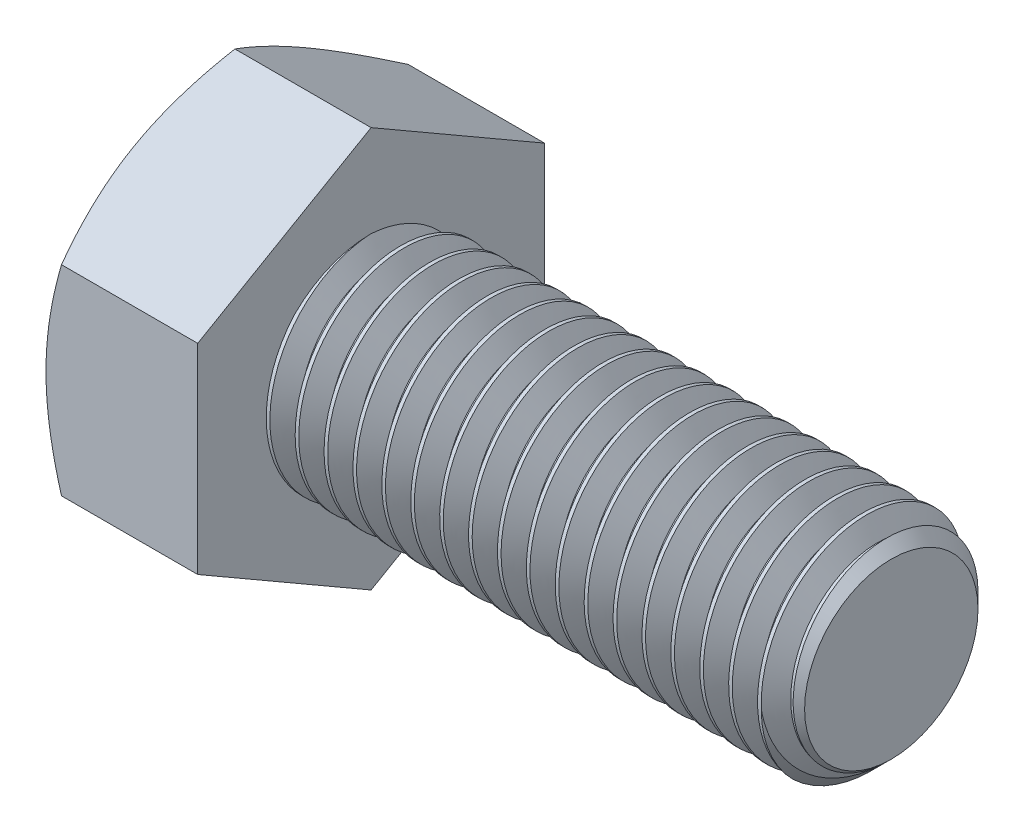
from build123d import *

# Parameters (mm, degrees)
SKETCH5_R           = 3.96875
BOSS_EXTRUDE3_DEPTH = 19.05
CHAMFER1_SIZE       = 0.79375
CUT_SWEEP1_PITCH    = 1.058333333
BOSS_EXTRUDE4_DEPTH = 5.55625
SKETCH8_OUTSIDE_W   = 116.054
SKETCH8_OUTSIDE_H   = 118.018
SKETCH8_OUTSIDE_R   = 6.35
CUT_EXTRUDE3_DEPTH  = 27.44907144
CUT_EXTRUDE3_DRAFT  = -60
CUT_EXTRUDE4_DEPTH  = 0.254
CIRPATTERN1_COUNT   = 6


with BuildPart() as part:
    # Sketch5 → Boss-Extrude3 (new body)
    with BuildSketch(Plane(origin=(12.303125, 0, 0), x_dir=(0, 0, -1), z_dir=(1, 0, 0))):
        Circle(SKETCH5_R)
    extrude(amount=-BOSS_EXTRUDE3_DEPTH)

    # Chamfer1
    chamfer1_edges = [part.edges().sort_by_distance(p)[0] for p in [
        (12.303125, 0, 3.96875),
    ]]
    chamfer(chamfer1_edges, length=CHAMFER1_SIZE)

    # Cut-Sweep1: arcs per turn and ends read off the stored shape
    # Cut-Sweep1: the profile of Sketch10 profile screwed along a right-hand helix through 19 turns, 8 arcs to a turn; built about Z, then put on its axis
    cut_sweep1_z = Axis((0, 0, 0), (0, 0, 1))
    cut_sweep1_corners = [(3.96905, 0, 0.000173205), (3.281342336, 0, -0.396875), (3.281342336, 0, -0.529166667), (3.96905, 0, -0.926214872)]
    with BuildLine(mode=Mode.PRIVATE) as cut_sweep1_profile:
        Line(cut_sweep1_corners[0], cut_sweep1_corners[1])
        Line(cut_sweep1_corners[1], cut_sweep1_corners[2])
        Line(cut_sweep1_corners[2], cut_sweep1_corners[3])
        Line(cut_sweep1_corners[3], cut_sweep1_corners[0])
    cut_sweep1_cap = Face(cut_sweep1_profile.wire())
    cut_sweep1_turn_angles = [0, 22.5, 45, 67.5, 90, 112.5, 135, 157.5, 180, 202.5, 225, 247.5, 270, 292.5, 315, 337.5, 360]
    cut_sweep1_turn_weights = [1, 0.9238795325112867, 1, 0.9238795325112867, 1, 0.9238795325112867, 1, 0.9238795325112867, 1, 0.9238795325112867, 1, 0.9238795325112867, 1, 0.9238795325112867, 1, 0.9238795325112867, 1]
    cut_sweep1_turn_rails = [Edge.make_bspline([Vector(p[0], p[1], 0).rotate(cut_sweep1_z, cut_sweep1_turn_angles[k]) / cut_sweep1_turn_weights[k] + Vector(0, 0, p[2] + CUT_SWEEP1_PITCH * cut_sweep1_turn_angles[k] / 360) for k in range(17)], [0, 0, 0, 1, 1, 2, 2, 3, 3, 4, 4, 5, 5, 6, 6, 7, 7, 8, 8, 8], 2, cut_sweep1_turn_weights) for p in cut_sweep1_corners]
    cut_sweep1_turn_sides = [Face.make_surface_from_curves(cut_sweep1_turn_rails[p[0]], cut_sweep1_turn_rails[p[1]]) for p in [(0, 1), (1, 2), (2, 3), (3, 0)]]
    cut_sweep1 = Plane(origin=(12.303125, 0, 0), x_dir=(0, 1, 0), z_dir=(-1, 0, 0)) * Solid(Shell([*[p.moved(Location((0, 0, CUT_SWEEP1_PITCH * i))) for i in range(19) for p in cut_sweep1_turn_sides], cut_sweep1_cap, cut_sweep1_cap.rotate(cut_sweep1_z, 6840).moved(Location((0, 0, CUT_SWEEP1_PITCH * 6840 / 360)))]))
    add(cut_sweep1, mode=Mode.SUBTRACT)

    # Sketch6 → Boss-Extrude4 (add)
    with BuildSketch(Plane.ZY.offset(6.746875)):
        Polygon((6.35, 3.666174209), (0, 7.332348419), (-6.35, 3.666174209), (-6.35, -3.666174209), (0, -7.332348419), (6.35, -3.666174209), align=None)
    extrude(amount=BOSS_EXTRUDE4_DEPTH)


with BuildPart() as cut_extrude3_tool:
    # Sketch8 outside → Cut-Extrude3 (with draft: the straight prism first)
    with BuildSketch(Plane.ZY.offset(12.303125)):
        Rectangle(SKETCH8_OUTSIDE_W, SKETCH8_OUTSIDE_H)
        Circle(SKETCH8_OUTSIDE_R, mode=Mode.SUBTRACT)
    extrude(amount=-CUT_EXTRUDE3_DEPTH)
    # Cut-Extrude3: the draft: its side faces are tilted about the plane it starts from
    cut_extrude3_sides = [cut_extrude3_tool.faces().sort_by_distance(p)[0] for p in [
        (1.42141072, -59.009, 0),
        (1.42141072, 0, 58.027),
        (1.42141072, 59.009, 0),
        (1.42141072, 0, -58.027),
        (1.42141072, 0, -6.35),
    ]]
    draft(cut_extrude3_sides, Plane.ZY.offset(12.303125), CUT_EXTRUDE3_DRAFT)


with BuildPart() as part_1:
    add(part.part)

    # Cut-Extrude3: cut by cut_extrude3_tool
    add(cut_extrude3_tool.part, mode=Mode.SUBTRACT)

    # Sketch12 → Cut-Extrude4 (cut)
    with BuildSketch(Plane.ZY.offset(12.303125)):
        with BuildLine():
            Line((0.1905, 4.8895), (0.1905, 2.7305))
            ThreePointArc((0.1905, 2.7305), (0, 2.54), (-0.1905, 2.7305))
            Line((-0.1905, 2.7305), (-0.1905, 4.8895))
            ThreePointArc((-0.1905, 4.8895), (0, 5.08), (0.1905, 4.8895))
        make_face()
    cut_extrude4 = extrude(amount=-CUT_EXTRUDE4_DEPTH, mode=Mode.SUBTRACT)

    # CirPattern1: Cut-Extrude4 ×6 about axis
    cirpattern1_axis = Axis((0, 0, 0), (1, 0, 0))
    for i in range(1, CIRPATTERN1_COUNT):
        add(cut_extrude4.rotate(cirpattern1_axis, i * 360 / CIRPATTERN1_COUNT), mode=Mode.SUBTRACT)


solid = part_1.part
